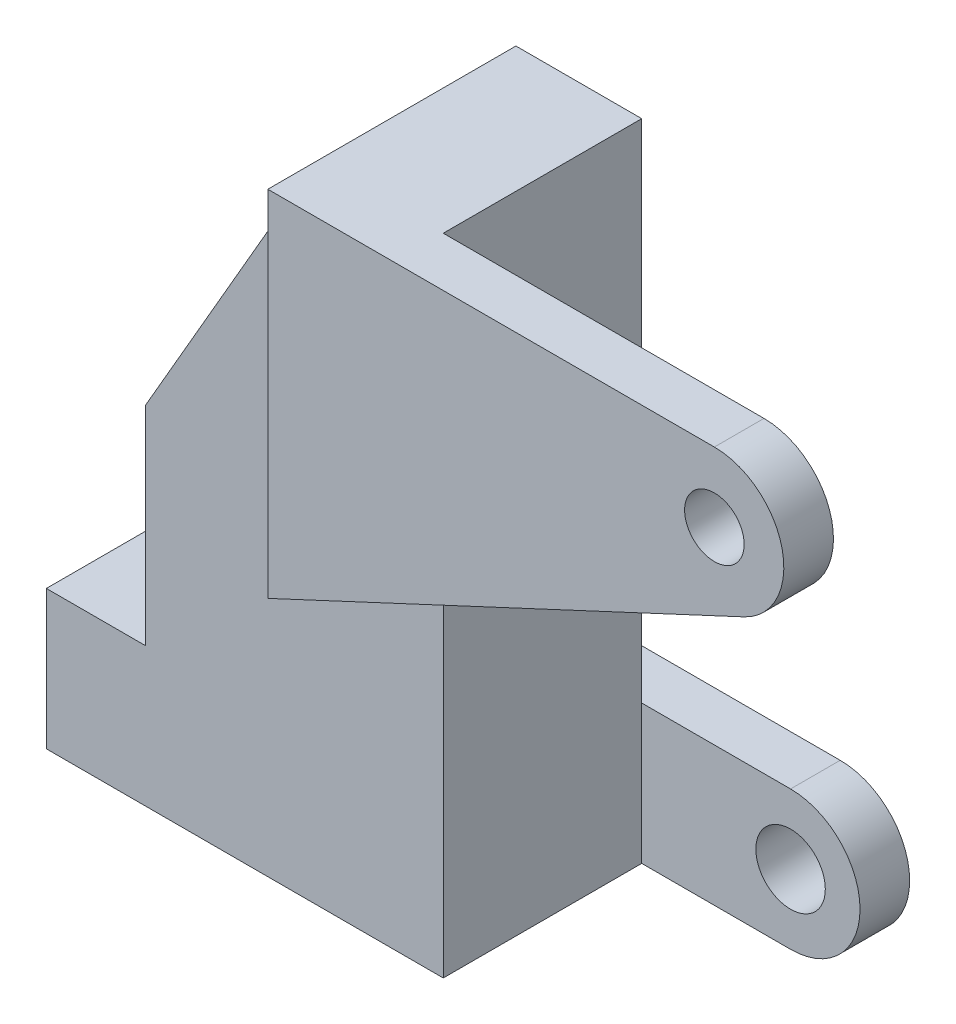
from build123d import *

# Parameters (mm, degrees)
BOSS_EXTRUDE5_DEPTH = 20
SKETCH1_4_R         = 3
BOSS_EXTRUDE6_DEPTH = 25
SKETCH1_5_R         = 3.5
BOSS_EXTRUDE7_DEPTH = 5
SKETCH1_6_R         = 3
CUT_EXTRUDE1_DEPTH  = 20


with BuildPart() as part:
    # Sketch1 → Boss-Extrude5 (new body)
    with BuildSketch(Plane.XY):
        Polygon((0, 0), (40, 0), (40, 65), (27.320508076, 65), (10, 35), (10, 14), (0, 14), align=None)
    extrude(amount=BOSS_EXTRUDE5_DEPTH)

    # Sketch1<4> → Boss-Extrude6 (add)
    with BuildSketch(Plane.XY):
        with BuildLine():
            Line((72.320508076, 65), (27.320508076, 65))
            Line((27.320508076, 65), (27.320508076, 29.29250995))
            Line((27.320508076, 29.29250995), (75.278835908, 51.655845491))
            ThreePointArc((75.278835908, 51.655845491), (79.154580126, 59.515077298), (72.320508076, 65))
        make_face()
        with Locations((72.320508076, 58)):
            Circle(SKETCH1_4_R, mode=Mode.SUBTRACT)
    extrude(amount=BOSS_EXTRUDE6_DEPTH)

    # Sketch1<5> → Boss-Extrude7 (add)
    with BuildSketch(Plane.XY):
        with BuildLine():
            Line((10, 14), (10, 0))
            Line((10, 0), (55, 0))
            ThreePointArc((55, 0), (62, 7), (55, 14))
            Line((55, 14), (10, 14))
        make_face()
        with Locations((55, 7)):
            Circle(SKETCH1_5_R, mode=Mode.SUBTRACT)
    extrude(amount=-BOSS_EXTRUDE7_DEPTH)

    # Sketch1<6> → Cut-Extrude1 (cut)
    with BuildSketch(Plane.XY):
        with BuildLine():
            Line((40, 65), (40, 35.205054136))
            Line((40, 35.205054136), (75.278835908, 51.655845491))
            ThreePointArc((75.278835908, 51.655845491), (79.154580126, 59.515077298), (72.320508076, 65))
            Line((72.320508076, 65), (40, 65))
        make_face()
        with Locations((72.320508076, 58)):
            Circle(SKETCH1_6_R, mode=Mode.SUBTRACT)
    extrude(amount=CUT_EXTRUDE1_DEPTH, mode=Mode.SUBTRACT)


solid = part.part
